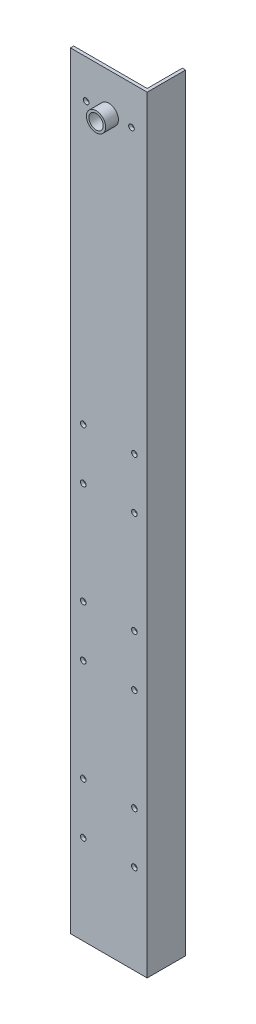
from build123d import *

# Parameters (mm, degrees)
SKETCH1_W           = 152.4
SKETCH1_H           = 76.2
BOSS_EXTRUDE1_DEPTH = 1524
CUT_EXTRUDE1_REACH  = 1529.805
SKETCH2_R           = 6.35
SKETCH4_R           = 19.05
SKETCH4_R_2         = 14.2875
BOSS_EXTRUDE2_DEPTH = 25.4
CUT_EXTRUDE2_REACH  = 1529.225
SKETCH6_W           = 152.4
SKETCH6_H           = 76.2
BOSS_EXTRUDE3_DEPTH = 6.35
CUT_EXTRUDE3_REACH  = 1529.502
SKETCH7_R           = 5.55625
CUT_EXTRUDE4_REACH  = 1529.805
SKETCH8_R           = 5.55625


with BuildPart() as part:
    # Sketch1 → Boss-Extrude1 (new body)
    with BuildSketch(Plane(origin=(0, 0, 0), x_dir=(1, 0, 0), z_dir=(0, 1, 0))):
        Rectangle(SKETCH1_W, SKETCH1_H)
    extrude(amount=BOSS_EXTRUDE1_DEPTH)

    # Sketch2 → Cut-Extrude1 (cut, up to next)
    with BuildSketch(Plane.XY.offset(38.1), mode=Mode.PRIVATE) as cut_extrude1_sk1:
        with Locations((0, 1447.8)):
            Circle(SKETCH2_R)
    cut_extrude1_tool1 = extrude(cut_extrude1_sk1.sketch, amount=-CUT_EXTRUDE1_REACH, mode=Mode.PRIVATE) & part.part
    add(cut_extrude1_tool1.solids().sort_by_distance((0, 1447.8, 38.1))[0], mode=Mode.SUBTRACT)

    # Sketch4 → Boss-Extrude2 (add)
    with BuildSketch(Plane.XY.offset(38.1)):
        with Locations((0, 1447.8)):
            Circle(SKETCH4_R)
        with Locations((0, 1447.8)):
            Circle(SKETCH4_R_2, mode=Mode.SUBTRACT)
    extrude(amount=BOSS_EXTRUDE2_DEPTH)

    # Sketch5 → Cut-Extrude2 (cut, up to next)
    with BuildSketch(Plane(origin=(0, 1524, 0), x_dir=(1, 0, 0), z_dir=(0, 1, 0)), mode=Mode.PRIVATE) as cut_extrude2_sk1:
        Polygon((69.85, 31.75), (69.85, 38.1), (-76.2, 38.1), (-76.2, -31.75), (-69.85, -31.75), (69.85, -31.75), align=None)
    cut_extrude2_tool1 = extrude(cut_extrude2_sk1.sketch, amount=-CUT_EXTRUDE2_REACH, mode=Mode.PRIVATE) & part.part
    add(cut_extrude2_tool1.solids().sort_by_distance((-3.175, 1524, -3.175))[0], mode=Mode.SUBTRACT)

    # Sketch6 → Boss-Extrude3 (add)
    with BuildSketch(Plane.XZ):
        Rectangle(SKETCH6_W, SKETCH6_H)
    extrude(amount=-BOSS_EXTRUDE3_DEPTH)

    # Sketch7 → Cut-Extrude3 (cut, up to next)
    with BuildSketch(Plane(origin=(0, 0, 31.75), x_dir=(-1, 0, 0), z_dir=(0, 0, -1)), mode=Mode.PRIVATE) as cut_extrude3_sk1:
        with Locations((-45.0453125, 1447.8)):
            Circle(SKETCH7_R)
    cut_extrude3_tool1 = extrude(cut_extrude3_sk1.sketch, amount=-CUT_EXTRUDE3_REACH, mode=Mode.PRIVATE) & part.part
    # Sketch7 → Cut-Extrude3 (cut, up to next)
    with BuildSketch(Plane(origin=(0, 0, 31.75), x_dir=(-1, 0, 0), z_dir=(0, 0, -1)), mode=Mode.PRIVATE) as cut_extrude3_sk2:
        with Locations((45.0453125, 1447.8)):
            Circle(SKETCH7_R)
    cut_extrude3_tool2 = extrude(cut_extrude3_sk2.sketch, amount=-CUT_EXTRUDE3_REACH, mode=Mode.PRIVATE) & part.part
    add(cut_extrude3_tool1.solids().sort_by_distance((45.045313, 1447.8, 31.75))[0], mode=Mode.SUBTRACT)
    add(cut_extrude3_tool2.solids().sort_by_distance((-45.045312, 1447.8, 31.75))[0], mode=Mode.SUBTRACT)

    # Sketch8 → Cut-Extrude4 (cut, up to next)
    with BuildSketch(Plane.XY.offset(38.1), mode=Mode.PRIVATE) as cut_extrude4_sk1:
        with Locations((-50.8, 177.8)):
            Circle(SKETCH8_R)
    cut_extrude4_tool1 = extrude(cut_extrude4_sk1.sketch, amount=-CUT_EXTRUDE4_REACH, mode=Mode.PRIVATE) & part.part
    # Sketch8 → Cut-Extrude4 (cut, up to next)
    with BuildSketch(Plane.XY.offset(38.1), mode=Mode.PRIVATE) as cut_extrude4_sk2:
        with Locations((50.8, 177.8)):
            Circle(SKETCH8_R)
    cut_extrude4_tool2 = extrude(cut_extrude4_sk2.sketch, amount=-CUT_EXTRUDE4_REACH, mode=Mode.PRIVATE) & part.part
    # Sketch8 → Cut-Extrude4 (cut, up to next)
    with BuildSketch(Plane.XY.offset(38.1), mode=Mode.PRIVATE) as cut_extrude4_sk3:
        with Locations((50.8, 279.4)):
            Circle(SKETCH8_R)
    cut_extrude4_tool3 = extrude(cut_extrude4_sk3.sketch, amount=-CUT_EXTRUDE4_REACH, mode=Mode.PRIVATE) & part.part
    # Sketch8 → Cut-Extrude4 (cut, up to next)
    with BuildSketch(Plane.XY.offset(38.1), mode=Mode.PRIVATE) as cut_extrude4_sk4:
        with Locations((-50.8, 279.4)):
            Circle(SKETCH8_R)
    cut_extrude4_tool4 = extrude(cut_extrude4_sk4.sketch, amount=-CUT_EXTRUDE4_REACH, mode=Mode.PRIVATE) & part.part
    # Sketch8 → Cut-Extrude4 (cut, up to next)
    with BuildSketch(Plane.XY.offset(38.1), mode=Mode.PRIVATE) as cut_extrude4_sk5:
        with Locations((50.8, 482.6)):
            Circle(SKETCH8_R)
    cut_extrude4_tool5 = extrude(cut_extrude4_sk5.sketch, amount=-CUT_EXTRUDE4_REACH, mode=Mode.PRIVATE) & part.part
    # Sketch8 → Cut-Extrude4 (cut, up to next)
    with BuildSketch(Plane.XY.offset(38.1), mode=Mode.PRIVATE) as cut_extrude4_sk6:
        with Locations((50.8, 584.2)):
            Circle(SKETCH8_R)
    cut_extrude4_tool6 = extrude(cut_extrude4_sk6.sketch, amount=-CUT_EXTRUDE4_REACH, mode=Mode.PRIVATE) & part.part
    # Sketch8 → Cut-Extrude4 (cut, up to next)
    with BuildSketch(Plane.XY.offset(38.1), mode=Mode.PRIVATE) as cut_extrude4_sk7:
        with Locations((-50.8, 584.2)):
            Circle(SKETCH8_R)
    cut_extrude4_tool7 = extrude(cut_extrude4_sk7.sketch, amount=-CUT_EXTRUDE4_REACH, mode=Mode.PRIVATE) & part.part
    # Sketch8 → Cut-Extrude4 (cut, up to next)
    with BuildSketch(Plane.XY.offset(38.1), mode=Mode.PRIVATE) as cut_extrude4_sk8:
        with Locations((-50.8, 482.6)):
            Circle(SKETCH8_R)
    cut_extrude4_tool8 = extrude(cut_extrude4_sk8.sketch, amount=-CUT_EXTRUDE4_REACH, mode=Mode.PRIVATE) & part.part
    # Sketch8 → Cut-Extrude4 (cut, up to next)
    with BuildSketch(Plane.XY.offset(38.1), mode=Mode.PRIVATE) as cut_extrude4_sk9:
        with Locations((-50.8, 889)):
            Circle(SKETCH8_R)
    cut_extrude4_tool9 = extrude(cut_extrude4_sk9.sketch, amount=-CUT_EXTRUDE4_REACH, mode=Mode.PRIVATE) & part.part
    # Sketch8 → Cut-Extrude4 (cut, up to next)
    with BuildSketch(Plane.XY.offset(38.1), mode=Mode.PRIVATE) as cut_extrude4_sk10:
        with Locations((-50.8, 787.4)):
            Circle(SKETCH8_R)
    cut_extrude4_tool10 = extrude(cut_extrude4_sk10.sketch, amount=-CUT_EXTRUDE4_REACH, mode=Mode.PRIVATE) & part.part
    # Sketch8 → Cut-Extrude4 (cut, up to next)
    with BuildSketch(Plane.XY.offset(38.1), mode=Mode.PRIVATE) as cut_extrude4_sk11:
        with Locations((50.8, 787.4)):
            Circle(SKETCH8_R)
    cut_extrude4_tool11 = extrude(cut_extrude4_sk11.sketch, amount=-CUT_EXTRUDE4_REACH, mode=Mode.PRIVATE) & part.part
    # Sketch8 → Cut-Extrude4 (cut, up to next)
    with BuildSketch(Plane.XY.offset(38.1), mode=Mode.PRIVATE) as cut_extrude4_sk12:
        with Locations((50.8, 889)):
            Circle(SKETCH8_R)
    cut_extrude4_tool12 = extrude(cut_extrude4_sk12.sketch, amount=-CUT_EXTRUDE4_REACH, mode=Mode.PRIVATE) & part.part
    add(cut_extrude4_tool1.solids().sort_by_distance((-50.8, 177.8, 38.1))[0], mode=Mode.SUBTRACT)
    add(cut_extrude4_tool2.solids().sort_by_distance((50.8, 177.8, 38.1))[0], mode=Mode.SUBTRACT)
    add(cut_extrude4_tool3.solids().sort_by_distance((50.8, 279.4, 38.1))[0], mode=Mode.SUBTRACT)
    add(cut_extrude4_tool4.solids().sort_by_distance((-50.8, 279.4, 38.1))[0], mode=Mode.SUBTRACT)
    add(cut_extrude4_tool5.solids().sort_by_distance((50.8, 482.6, 38.1))[0], mode=Mode.SUBTRACT)
    add(cut_extrude4_tool6.solids().sort_by_distance((50.8, 584.2, 38.1))[0], mode=Mode.SUBTRACT)
    add(cut_extrude4_tool7.solids().sort_by_distance((-50.8, 584.2, 38.1))[0], mode=Mode.SUBTRACT)
    add(cut_extrude4_tool8.solids().sort_by_distance((-50.8, 482.6, 38.1))[0], mode=Mode.SUBTRACT)
    add(cut_extrude4_tool9.solids().sort_by_distance((-50.8, 889, 38.1))[0], mode=Mode.SUBTRACT)
    add(cut_extrude4_tool10.solids().sort_by_distance((-50.8, 787.4, 38.1))[0], mode=Mode.SUBTRACT)
    add(cut_extrude4_tool11.solids().sort_by_distance((50.8, 787.4, 38.1))[0], mode=Mode.SUBTRACT)
    add(cut_extrude4_tool12.solids().sort_by_distance((50.8, 889, 38.1))[0], mode=Mode.SUBTRACT)


solid = part.part
